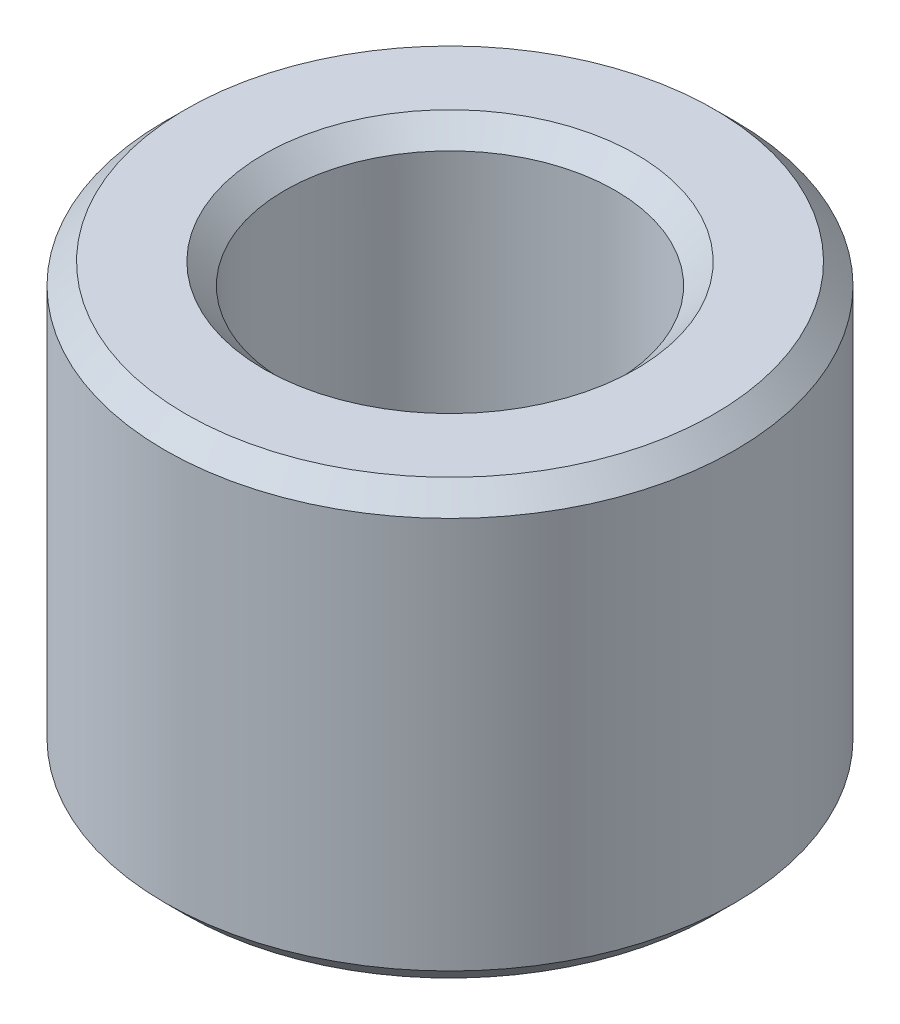
from build123d import *

# Parameters (mm, degrees)
SKETCH1_R           = 50
BOSS_EXTRUDE1_DEPTH = 76.088071402
SKETCH2_R           = 28.986800942
CUT_EXTRUDE1_DEPTH  = 104.872010714
CHAMFER1_SIZE       = 3.661186918


with BuildPart() as part:
    # Sketch1 → Boss-Extrude1 (new body)
    with BuildSketch(Plane(origin=(0, 0, 0), x_dir=(1, 0, 0), z_dir=(0, 1, 0))):
        Circle(SKETCH1_R)
    extrude(amount=BOSS_EXTRUDE1_DEPTH)

    # Sketch2 → Cut-Extrude1 (cut, through all)
    with BuildSketch(Plane(origin=(0, 0, 0), x_dir=(1, 0, 0), z_dir=(0, 1, 0))):
        Circle(SKETCH2_R)
    extrude(amount=CUT_EXTRUDE1_DEPTH, mode=Mode.SUBTRACT)

    # Chamfer1
    chamfer1_edges = [part.edges().sort_by_distance(p)[0] for p in [
        (-28.986800942, 76.088071402, 0),
        (-28.986800942, 0, 0),
        (-50, 0, 0),
        (-50, 76.088071402, 0),
    ]]
    chamfer(chamfer1_edges, length=CHAMFER1_SIZE)


solid = part.part
